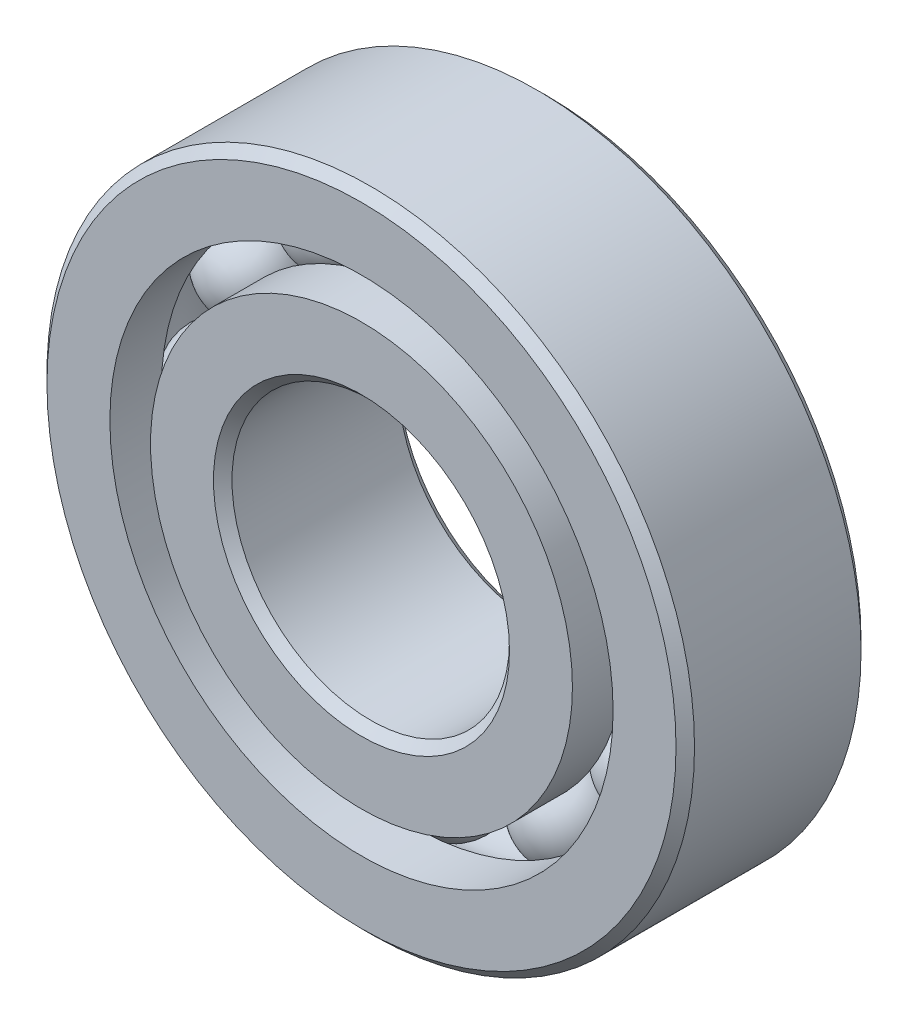
from build123d import *

# Parameters (mm, degrees)
CIRPATTERN1_COUNT = 12


with BuildPart() as part:
    # Sketch1 → Revolve1 (revolve)
    with BuildSketch(Plane(origin=(0, 0, 0), x_dir=(0, 0, -1), z_dir=(1, 0, 0))):
        with BuildLine():
            Line((3.6, 14), (-3.6, 14))
            Line((-3.6, 14), (-4, 13.6))
            Line((-4, 13.6), (-4, 10.879120879))
            Line((-4, 10.879120879), (-1.777777778, 10.879120879))
            ThreePointArc((-1.777777778, 10.879120879), (0, 11.983266837), (1.777777778, 10.879120879))
            Line((1.777777778, 10.879120879), (4, 10.879120879))
            Line((4, 10.879120879), (4, 13.6))
            Line((4, 13.6), (3.6, 14))
        make_face()
    revolve(axis=Axis((0, 0, 4), (0, 0, -1)))


with BuildPart() as body_2:
    # Sketch3 → Revolve3 (revolve)
    with BuildSketch(Plane(origin=(0, 0, 0), x_dir=(0, 0, -1), z_dir=(1, 0, 0))):
        with BuildLine():
            Line((-4, 9.120879121), (-1.777777778, 9.120879121))
            ThreePointArc((-1.777777778, 9.120879121), (0, 8.016733163), (1.777777778, 9.120879121))
            Line((1.777777778, 9.120879121), (4, 9.120879121))
            Line((4, 9.120879121), (4, 6.4))
            Line((4, 6.4), (3.6, 6))
            Line((3.6, 6), (-3.6, 6))
            Line((-3.6, 6), (-4, 6.4))
            Line((-4, 6.4), (-4, 9.120879121))
        make_face()
    revolve(axis=Axis((0, 0, 4), (0, 0, -1)))


with BuildPart() as body_3:
    # Sketch4 → Revolve4 (revolve)
    with BuildSketch(Plane(origin=(0, 0, 0), x_dir=(0, 0, -1), z_dir=(1, 0, 0))):
        with BuildLine():
            Line((-1.983266837, 10), (1.983266837, 10))
            ThreePointArc((1.983266837, 10), (0, 11.983266837), (-1.983266837, 10))
        make_face()
    revolve(axis=Axis((0, 10, 1.983266837), (0, 0, -1)))


with BuildPart() as cirpattern1_1:
    # CirPattern1: pattern copy
    add(body_3.part.rotate(Axis((0, 0, -4), (0, 0, 1)), 1 * 360 / CIRPATTERN1_COUNT))


with BuildPart() as cirpattern1_2:
    # CirPattern1: pattern copy
    add(body_3.part.rotate(Axis((0, 0, -4), (0, 0, 1)), 2 * 360 / CIRPATTERN1_COUNT))


with BuildPart() as cirpattern1_3:
    # CirPattern1: pattern copy
    add(body_3.part.rotate(Axis((0, 0, -4), (0, 0, 1)), 3 * 360 / CIRPATTERN1_COUNT))


with BuildPart() as cirpattern1_4:
    # CirPattern1: pattern copy
    add(body_3.part.rotate(Axis((0, 0, -4), (0, 0, 1)), 4 * 360 / CIRPATTERN1_COUNT))


with BuildPart() as cirpattern1_5:
    # CirPattern1: pattern copy
    add(body_3.part.rotate(Axis((0, 0, -4), (0, 0, 1)), 5 * 360 / CIRPATTERN1_COUNT))


with BuildPart() as cirpattern1_6:
    # CirPattern1: pattern copy
    add(body_3.part.rotate(Axis((0, 0, -4), (0, 0, 1)), 6 * 360 / CIRPATTERN1_COUNT))


with BuildPart() as cirpattern1_7:
    # CirPattern1: pattern copy
    add(body_3.part.rotate(Axis((0, 0, -4), (0, 0, 1)), 7 * 360 / CIRPATTERN1_COUNT))


with BuildPart() as cirpattern1_8:
    # CirPattern1: pattern copy
    add(body_3.part.rotate(Axis((0, 0, -4), (0, 0, 1)), 8 * 360 / CIRPATTERN1_COUNT))


with BuildPart() as cirpattern1_9:
    # CirPattern1: pattern copy
    add(body_3.part.rotate(Axis((0, 0, -4), (0, 0, 1)), 9 * 360 / CIRPATTERN1_COUNT))


with BuildPart() as cirpattern1_10:
    # CirPattern1: pattern copy
    add(body_3.part.rotate(Axis((0, 0, -4), (0, 0, 1)), 10 * 360 / CIRPATTERN1_COUNT))


with BuildPart() as cirpattern1_11:
    # CirPattern1: pattern copy
    add(body_3.part.rotate(Axis((0, 0, -4), (0, 0, 1)), 11 * 360 / CIRPATTERN1_COUNT))


solid = Compound([part.part, body_2.part, body_3.part, cirpattern1_1.part, cirpattern1_2.part, cirpattern1_3.part, cirpattern1_4.part, cirpattern1_5.part, cirpattern1_6.part, cirpattern1_7.part, cirpattern1_8.part, cirpattern1_9.part, cirpattern1_10.part, cirpattern1_11.part])
